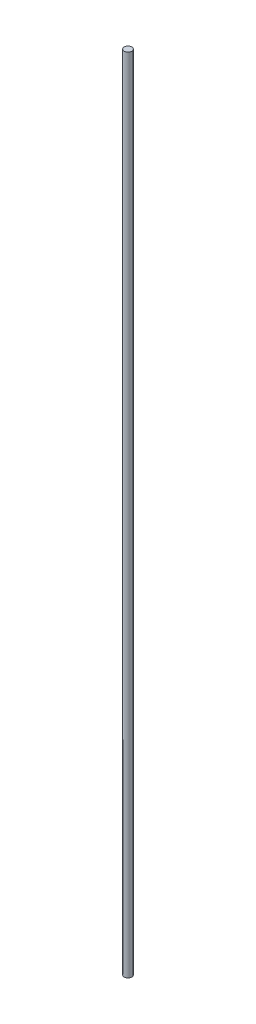
from build123d import *

# Parameters (mm, degrees)
SKETCH_2_W = 2.5
SKETCH_2_H = 529.4


with BuildPart() as part:
    # Эскиз2 → Повернуть1 (revolve)
    with BuildSketch(Plane.XY):
        with Locations((-1.25, 87.857099555)):
            Rectangle(SKETCH_2_W, SKETCH_2_H)
    revolve(axis=Axis((-2.5, 352.557099555, 0), (0, -1, 0)))


solid = part.part
